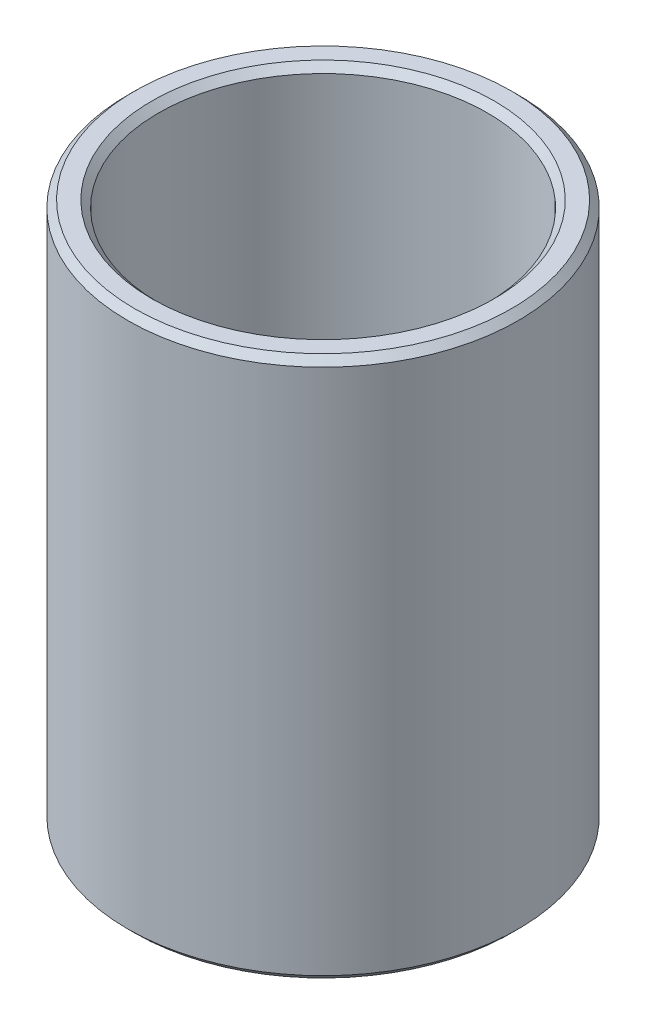
from build123d import *

# Parameters (mm, degrees)
SKETCH1_R           = 37.5
BOSS_EXTRUDE1_DEPTH = 103.796878859
SKETCH2_R           = 31.565476046
CUT_EXTRUDE1_DEPTH  = 117.560250775
CHAMFER1_SIZE       = 1.316492392


with BuildPart() as part:
    # Sketch1 → Boss-Extrude1 (new body)
    with BuildSketch(Plane(origin=(0, 0, 0), x_dir=(1, 0, 0), z_dir=(0, 1, 0))):
        Circle(SKETCH1_R)
    extrude(amount=BOSS_EXTRUDE1_DEPTH)

    # Sketch2 → Cut-Extrude1 (cut, through all)
    with BuildSketch(Plane(origin=(0, 0, 0), x_dir=(1, 0, 0), z_dir=(0, 1, 0))):
        Circle(SKETCH2_R)
    extrude(amount=CUT_EXTRUDE1_DEPTH, mode=Mode.SUBTRACT)

    # Chamfer1
    chamfer1_edges = [part.edges().sort_by_distance(p)[0] for p in [
        (-31.565476046, 103.796878859, 0),
        (-31.565476046, 0, 0),
        (-37.5, 0, 0),
        (-37.5, 103.796878859, 0),
    ]]
    chamfer(chamfer1_edges, length=CHAMFER1_SIZE)


solid = part.part
